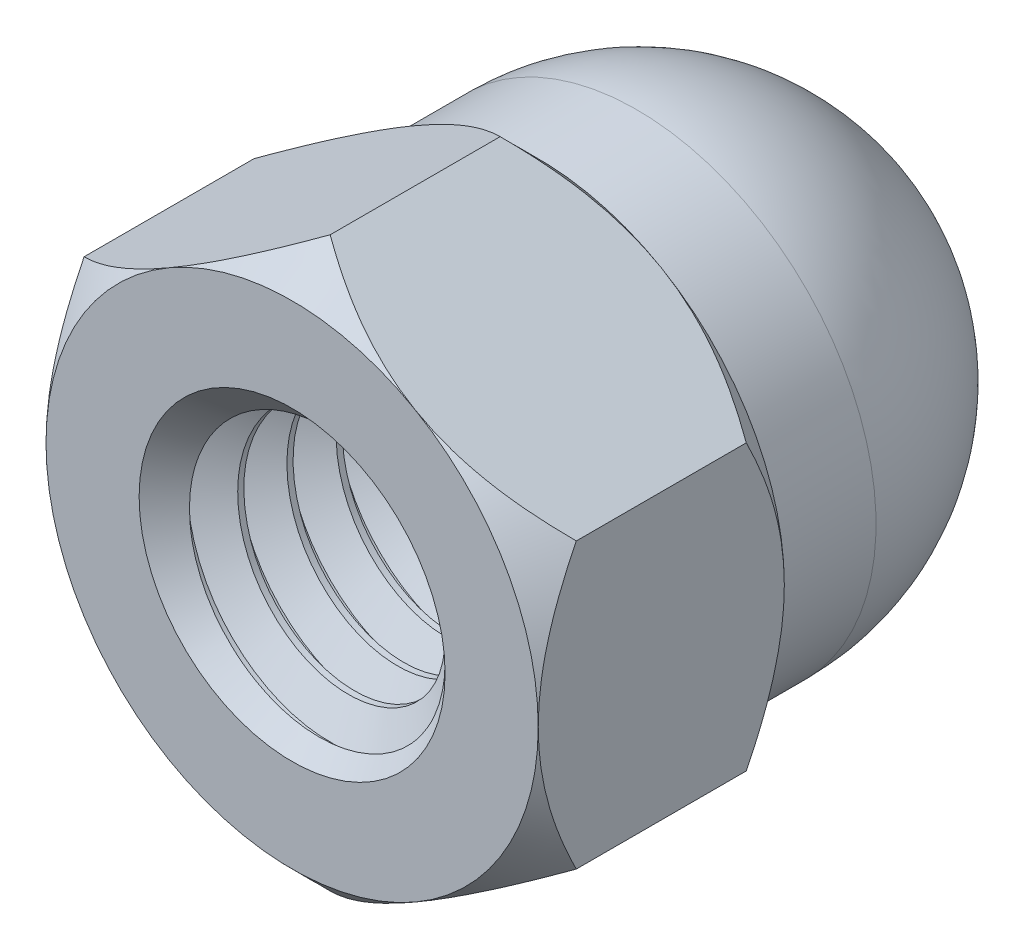
from build123d import *

# Parameters (mm, degrees)
BOSS_EXTRUDE2_DEPTH          = 5
SKETCH8_OUTSIDE_W            = 35.472
SKETCH8_OUTSIDE_H            = 37.02
SKETCH8_OUTSIDE_R            = 5
CUT_EXTRUDE3_DEPTH           = 10.128709292
CUT_EXTRUDE3_DRAFT           = -45
SKETCH9_OUTSIDE_W            = 35.472
SKETCH9_OUTSIDE_H            = 37.02
SKETCH9_OUTSIDE_R            = 5
CUT_EXTRUDE4_DEPTH           = 10.128709292
CUT_EXTRUDE4_DRAFT           = 45
SWEEP1_PITCH                 = 1
SWEEP1_HEIGHT                = 8.71
SWEEP1_RADIUS                = 3
SWEEP1_START_ANGLE           = 90
SKETCH15_R                   = 3.108253175
CUT_EXTRUDE5_OTHER_WAY_DEPTH = 15.224392315
CUT_EXTRUDE5_OTHER_WAY_TAPER = -45


with BuildPart() as part:
    # Sketch7 → Boss-Extrude2 (new body)
    with BuildSketch(Plane.XY.offset(6)):
        Polygon((0, 5.773502692), (-5, 2.886751346), (-5, -2.886751346), (0, -5.773502692), (5, -2.886751346), (5, 2.886751346), align=None)
    extrude(amount=-BOSS_EXTRUDE2_DEPTH)


with BuildPart() as cut_extrude3_tool:
    # Sketch8 outside → Cut-Extrude3 (with draft: the straight prism first)
    with BuildSketch(Plane.XY.offset(6)):
        Rectangle(SKETCH8_OUTSIDE_W, SKETCH8_OUTSIDE_H)
        Circle(SKETCH8_OUTSIDE_R, mode=Mode.SUBTRACT)
    extrude(amount=-CUT_EXTRUDE3_DEPTH)
    # Cut-Extrude3: the draft: its side faces are tilted about the plane it starts from
    cut_extrude3_sides = [cut_extrude3_tool.faces().sort_by_distance(p)[0] for p in [
        (0, -18.51, 0.935645354),
        (17.736, 0, 0.935645354),
        (0, 18.51, 0.935645354),
        (-17.736, 0, 0.935645354),
        (-5, 0, 0.935645354),
    ]]
    draft(cut_extrude3_sides, Plane.XY.offset(6), CUT_EXTRUDE3_DRAFT)


with BuildPart() as part_1:
    add(part.part)

    # Cut-Extrude3: cut by cut_extrude3_tool
    add(cut_extrude3_tool.part, mode=Mode.SUBTRACT)


with BuildPart() as cut_extrude4_tool:
    # Sketch9 outside → Cut-Extrude4 (with draft: the straight prism first)
    with BuildSketch(Plane.XY.offset(1)):
        Rectangle(SKETCH9_OUTSIDE_W, SKETCH9_OUTSIDE_H)
        Circle(SKETCH9_OUTSIDE_R, mode=Mode.SUBTRACT)
    extrude(amount=CUT_EXTRUDE4_DEPTH)
    # Cut-Extrude4: the draft: its side faces are tilted about the plane it starts from
    cut_extrude4_sides = [cut_extrude4_tool.faces().sort_by_distance(p)[0] for p in [
        (0, -18.51, 6.064354646),
        (17.736, 0, 6.064354646),
        (0, 18.51, 6.064354646),
        (-17.736, 0, 6.064354646),
        (-5, 0, 6.064354646),
    ]]
    draft(cut_extrude4_sides, Plane.XY.offset(1), CUT_EXTRUDE4_DRAFT)


with BuildPart() as part_2:
    add(part_1.part)

    # Cut-Extrude4: cut by cut_extrude4_tool
    add(cut_extrude4_tool.part, mode=Mode.SUBTRACT)

    # Sketch10 → Revolve1 (revolve)
    with BuildSketch(Plane(origin=(0, 0, 0), x_dir=(0, 0, -1), z_dir=(1, 0, 0))):
        with BuildLine():
            Line((1, 5), (-1, 5))
            Line((-1, 5), (-1, 0))
            Line((-1, 0), (6, 0))
            ThreePointArc((6, 0), (4.535533906, 3.535533906), (1, 5))
        make_face()
    revolve(axis=Axis((0, 0, -6), (0, 0, 1)))

    # Sketch11 → Cut-Revolve1 (revolve, cut)
    with BuildSketch(Plane(origin=(0, 0, 0), x_dir=(0, 0, -1), z_dir=(1, 0, 0)), mode=Mode.PRIVATE) as cut_revolve1_sk:
        Polygon((-6, 0), (-6, 3), (1.71, 3), (2.513847577, 0), align=None)
    revolve(cut_revolve1_sk.sketch.rotate(Axis((0, 0, -6), (0, 0, 1)), 90), axis=Axis((0, 0, -6), (0, 0, 1)), mode=Mode.SUBTRACT)

    # Sweep1: sweep along a helix
    with BuildLine() as sweep1_path:
        add(Helix(SWEEP1_PITCH, SWEEP1_HEIGHT, SWEEP1_RADIUS, center=(0, 0, 6), direction=(0, 0, -1), mode=Mode.PRIVATE).rotate(Axis((0, 0, 6), (0, 0, -1)), SWEEP1_START_ANGLE))
    # Sketch13 → Sweep1 (sweep)
    with BuildSketch(Plane(origin=(0, 0, 0), x_dir=(0, 0, -1), z_dir=(1, 0, 0))):
        Polygon((-6.90625, 3.054126588), (-6.5, 2.350480947), (-6.375, 2.350480947), (-5.96875, 3.054126588), align=None)
    sweep(path=sweep1_path.line, is_frenet=True)

    # Sketch14 → Cut-Revolve4 (revolve, cut)
    with BuildSketch(Plane(origin=(0, 0, 0), x_dir=(0, 0, -1), z_dir=(1, 0, 0)), mode=Mode.PRIVATE) as cut_revolve4_sk:
        with BuildLine():
            Line((1, 4.862882074), (-1, 4.862882074))
            Line((-1, 4.862882074), (-1, 5))
            Line((-1, 5), (1, 5))
            Line((1, 5), (6, 5))
            Line((6, 5), (6.274235852, 5))
            Line((6.274235852, 5), (6.274235852, 1.5))
            Line((6.274235852, 1.5), (6.274235852, 0))
            Line((6.274235852, 0), (6, 0))
            ThreePointArc((6, 0), (4.487392366, 3.446674752), (1, 4.862882074))
        make_face()
    revolve(cut_revolve4_sk.sketch.rotate(Axis((0, 0, -6), (0, 0, 1)), 270), axis=Axis((0, 0, -6), (0, 0, 1)), mode=Mode.SUBTRACT)

    # Cut-Extrude5 cone 1 section (through the dimple's axis) → Cut-Extrude5 (revolve, cut)
    with BuildSketch(Plane(origin=(0, 0, 6), x_dir=(0, -1, 0), z_dir=(1, 0, 0))):
        Polygon((0, 0), (3.108253175, 0), (0, 3.108253175), align=None)
    revolve(axis=Axis((0, 0, 6), (0, 0, -1)), mode=Mode.SUBTRACT)

    # Sketch15 → Cut-Extrude5 other way (cut)
    with BuildSketch(Plane.XY.offset(6)):
        Circle(SKETCH15_R)
    extrude(amount=CUT_EXTRUDE5_OTHER_WAY_DEPTH, taper=CUT_EXTRUDE5_OTHER_WAY_TAPER, mode=Mode.SUBTRACT)


solid = part_2.part
